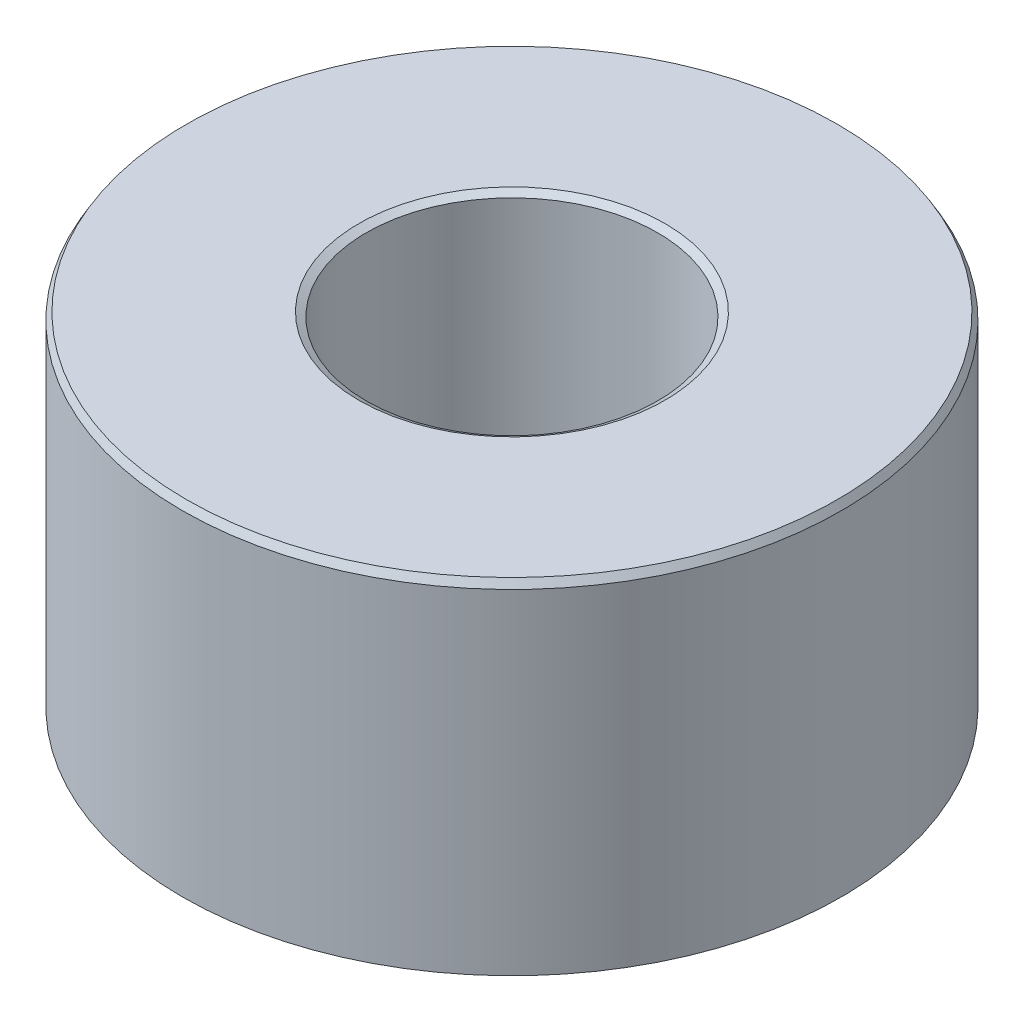
from build123d import *
from OCP.BRepFilletAPI import BRepFilletAPI_MakeChamfer

# Parameters (mm, degrees)
SKETCH1_R           = 42.5
BOSS_EXTRUDE1_DEPTH = 44.637134893
SKETCH2_R           = 18.792952379
CUT_EXTRUDE1_DEPTH  = 75.866373035
CHAMFER1_SIZE       = 0.950105719
CHAMFER1_SIZE2      = 0.548543793


with BuildPart() as part:
    # Sketch1 → Boss-Extrude1 (new body)
    with BuildSketch(Plane(origin=(0, 0, 0), x_dir=(1, 0, 0), z_dir=(0, 1, 0))):
        Circle(SKETCH1_R)
    extrude(amount=BOSS_EXTRUDE1_DEPTH)

    # Sketch2 → Cut-Extrude1 (cut, through all)
    with BuildSketch(Plane(origin=(0, 0, 0), x_dir=(1, 0, 0), z_dir=(0, 1, 0))):
        Circle(SKETCH2_R)
    extrude(amount=CUT_EXTRUDE1_DEPTH, mode=Mode.SUBTRACT)

    # Chamfer1: one chamfer whose edges measure the first distance from different faces: ONE call of the kernel's chamfer builder (chamfer() names one face for all edges)
    chamfer1_edges_1 = [part.edges().sort_by_distance(p)[0] for p in [
        (-18.792952379, 44.637134893, 0),
    ]]
    chamfer1_side_1 = [part.faces().sort_by_distance(p)[0] for p in [
        (-41.297918472, 44.637134893, 0),
    ]]
    chamfer1_edges_2 = [part.edges().sort_by_distance(p)[0] for p in [
        (-18.792952379, 0, 0),
    ]]
    chamfer1_side_2 = [part.faces().sort_by_distance(p)[0] for p in [
        (-18.792952379, 22.318567446, 0),
    ]]
    chamfer1_edges_3 = [part.edges().sort_by_distance(p)[0] for p in [
        (-42.5, 0, 0),
    ]]
    chamfer1_side_3 = [part.faces().sort_by_distance(p)[0] for p in [
        (-41.297918472, 0, 0),
    ]]
    chamfer1_edges_4 = [part.edges().sort_by_distance(p)[0] for p in [
        (-42.5, 44.637134893, 0),
    ]]
    chamfer1_side_4 = [part.faces().sort_by_distance(p)[0] for p in [
        (-42.5, 22.318567446, 0),
    ]]
    chamfer1 = BRepFilletAPI_MakeChamfer(part.part.solid().wrapped)
    for e in chamfer1_edges_1:
        chamfer1.Add(CHAMFER1_SIZE, CHAMFER1_SIZE2, e.wrapped, chamfer1_side_1[0].wrapped)  # the first distance lies on this face
    for e in chamfer1_edges_2:
        chamfer1.Add(CHAMFER1_SIZE, CHAMFER1_SIZE2, e.wrapped, chamfer1_side_2[0].wrapped)  # the first distance lies on this face
    for e in chamfer1_edges_3:
        chamfer1.Add(CHAMFER1_SIZE, CHAMFER1_SIZE2, e.wrapped, chamfer1_side_3[0].wrapped)  # the first distance lies on this face
    for e in chamfer1_edges_4:
        chamfer1.Add(CHAMFER1_SIZE, CHAMFER1_SIZE2, e.wrapped, chamfer1_side_4[0].wrapped)  # the first distance lies on this face
    add(Compound.cast(chamfer1.Shape()), mode=Mode.REPLACE)


solid = part.part
